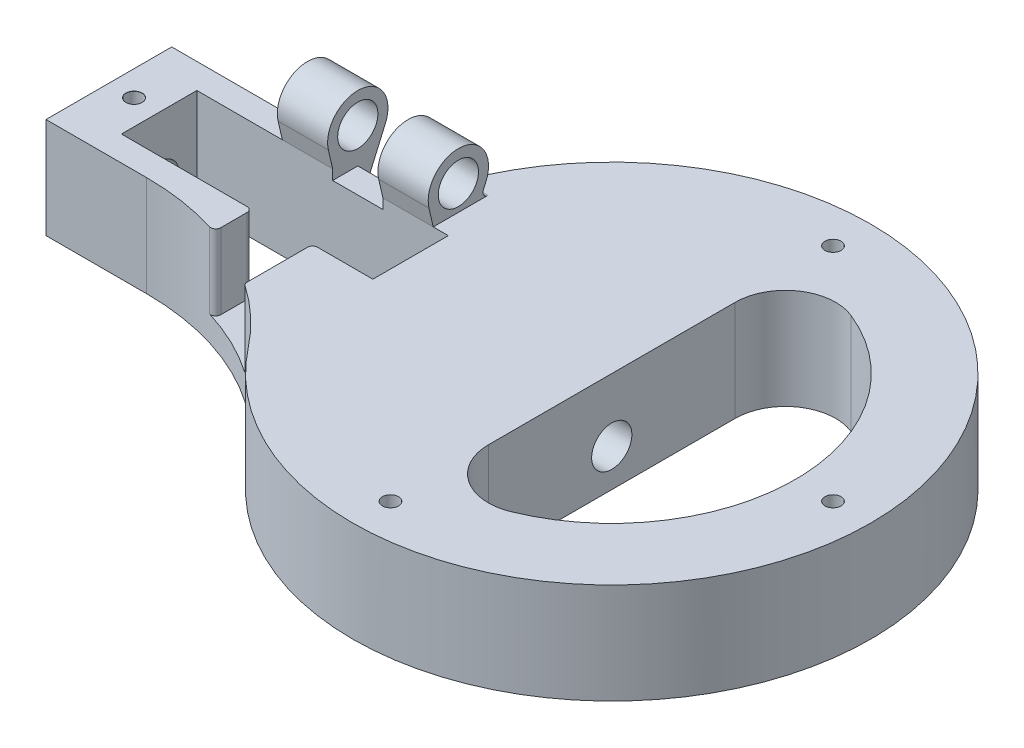
from build123d import *

# Parameters (mm, degrees)
SKETCH2_W                            = 100
SKETCH2_H                            = 25
SKETCH2_W_2                          = 40
SKETCH2_H_2                          = 15
BOSS_EXTRUDE1_DEPTH                  = 20
CUT_EXTRUDE1_REACH                   = 104.744
SKETCH3_R                            = 4
CUT_EXTRUDE2_REACH                   = 104.744
SKETCH4_R                            = 4
F_3_2_3_2_DIAMETER_HOLE1_D           = 3.2
F_3_2_3_2_DIAMETER_HOLE1_CSINK_D     = 3.25
F_3_2_3_2_DIAMETER_HOLE1_CSINK_ANGLE = 90
SKETCH9_R                            = 4
BOSS_EXTRUDE3_DEPTH                  = 40
CUT_EXTRUDE3_DEPTH                   = 71.434366612
CUT_EXTRUDE3_DEPTH_BACK              = 71.434366612
SKETCH12_W                           = 7
SKETCH12_H                           = 15
SKETCH12_W_2                         = 10
SKETCH12_W_3                         = 3
SKETCH11_R                           = 1.6
BOSS_EXTRUDE4_DEPTH                  = 20
FILLET1_R                            = 10
SKETCH13_W                           = 7
SKETCH13_H                           = 4.364357805
SKETCH13_W_2                         = 10
CUT_EXTRUDE4_DEPTH                   = 125.436730928
FILLET3_R                            = 1
FILLET4_R                            = 50
SKETCH14_W                           = 12
SKETCH14_H                           = 15
CUT_EXTRUDE5_DEPTH                   = 15
SKETCH15_W                           = 10
SKETCH15_H                           = 15
CUT_EXTRUDE6_DEPTH                   = 125.436731059
SKETCH16_W                           = 10
SKETCH16_H                           = 5
CUT_EXTRUDE7_DEPTH                   = 2
FILLET5_R                            = 1


with BuildPart() as part:
    # Sketch2 → Boss-Extrude1 (new body)
    with BuildSketch(Plane(origin=(0, 0, 0), x_dir=(1, 0, 0), z_dir=(0, 1, 0))):
        with Locations((10, 0)):
            Rectangle(SKETCH2_W, SKETCH2_H)
        Rectangle(SKETCH2_W_2, SKETCH2_H_2, mode=Mode.SUBTRACT)
    extrude(amount=BOSS_EXTRUDE1_DEPTH)

    # Sketch3 → Cut-Extrude1 (cut, up to next)
    with BuildSketch(Plane(origin=(60, 0, 0), x_dir=(0, 0, -1), z_dir=(1, 0, 0)), mode=Mode.PRIVATE) as cut_extrude1_sk1:
        with Locations((0, 7.5)):
            Circle(SKETCH3_R)
    cut_extrude1_tool1 = extrude(cut_extrude1_sk1.sketch, amount=-CUT_EXTRUDE1_REACH, mode=Mode.PRIVATE) & part.part
    add(cut_extrude1_tool1.solids().sort_by_distance((60, 7.5, 0))[0], mode=Mode.SUBTRACT)

    # Sketch4 → Cut-Extrude2 (cut, up to next)
    with BuildSketch(Plane.ZY.offset(40), mode=Mode.PRIVATE) as cut_extrude2_sk1:
        with Locations((0, 7.5)):
            Circle(SKETCH4_R)
    cut_extrude2_tool1 = extrude(cut_extrude2_sk1.sketch, amount=-CUT_EXTRUDE2_REACH, mode=Mode.PRIVATE) & part.part
    add(cut_extrude2_tool1.solids().sort_by_distance((-40, 7.5, 0))[0], mode=Mode.SUBTRACT)

    # Ø3.2 (3.2) Diameter Hole1 (through all)
    with Locations(Plane(origin=(0, 20, 0), x_dir=(1, 0, 0), z_dir=(0, 1, 0))):
        with Locations((-35, 0)):
            CounterSinkHole(F_3_2_3_2_DIAMETER_HOLE1_D / 2, F_3_2_3_2_DIAMETER_HOLE1_CSINK_D / 2, counter_sink_angle=F_3_2_3_2_DIAMETER_HOLE1_CSINK_ANGLE)

    # Sketch9 → Boss-Extrude3 (add)
    with BuildSketch(Plane(origin=(-20, 0, 0), x_dir=(0, 0, -1), z_dir=(1, 0, 0))):
        with BuildLine():
            Line((7.5, 20), (12.5, 20))
            Line((12.5, 20), (12.5, 10))
            Line((12.5, 10), (17.999090834, 22.6))
            ThreePointArc((17.999090834, 22.6), (13.050377748, 30.974703703), (6.655005568, 23.644994432))
            Line((6.655005568, 23.644994432), (7.5, 20))
        make_face()
        with Locations((12.5, 25)):
            Circle(SKETCH9_R, mode=Mode.SUBTRACT)
    extrude(amount=BOSS_EXTRUDE3_DEPTH)

    # Sketch12 → Cut-Extrude3 (cut, two sides: drawn at the far end of the back side and taken through both)
    with BuildSketch(Plane.XY.offset(-7.5).offset(-CUT_EXTRUDE3_DEPTH_BACK)):
        with Locations((-16.5, 27.5)):
            Rectangle(SKETCH12_W, SKETCH12_H)
        with Locations((2, 27.5)):
            Rectangle(SKETCH12_W_2, SKETCH12_H)
        with Locations((18.5, 27.5)):
            Rectangle(SKETCH12_W_3, SKETCH12_H)
    extrude(amount=CUT_EXTRUDE3_DEPTH + CUT_EXTRUDE3_DEPTH_BACK, mode=Mode.SUBTRACT)

    # Sketch11 → Boss-Extrude4 (add)
    with BuildSketch(Plane.XZ):
        with BuildLine():
            Line((60, 12.5), (60, 36.5))
            ThreePointArc((60, 36.5), (96.5, 0), (60, -36.5))
            Line((60, -36.5), (60, -12.5))
            Line((60, -12.5), (10.040016013, -12.5))
            ThreePointArc((10.040016013, -12.5), (111.5, 0), (10.040016013, 12.5))
            Line((10.040016013, 12.5), (60, 12.5))
        make_face()
        with Locations((60, 44)):
            Circle(SKETCH11_R, mode=Mode.SUBTRACT)
        with Locations((60, -44)):
            Circle(SKETCH11_R, mode=Mode.SUBTRACT)
        with Locations((104, 0)):
            Circle(SKETCH11_R, mode=Mode.SUBTRACT)
    extrude(amount=-BOSS_EXTRUDE4_DEPTH)

    # Fillet1
    fillet1_edges = [part.edges().sort_by_distance(p)[0] for p in [
        (60, 10, 36.5),
        (60, 10, -36.5),
    ]]
    fillet(fillet1_edges, radius=FILLET1_R)

    # Sketch13 → Cut-Extrude4 (cut, through all)
    with BuildSketch(Plane(origin=(0, 20, 0), x_dir=(1, 0, 0), z_dir=(0, 1, 0))):
        with Locations((-16.5, 14.682178903)):
            Rectangle(SKETCH13_W, SKETCH13_H)
        with Locations((2, 14.682178903)):
            Rectangle(SKETCH13_W_2, SKETCH13_H)
    extrude(amount=-CUT_EXTRUDE4_DEPTH, mode=Mode.SUBTRACT)

    # Fillet3
    fillet3_edges = [part.edges().sort_by_distance(p)[0] for p in [
        (-8, 10, -12.5),
        (14.169754236, 20, -16.864357805),
    ]]
    fillet(fillet3_edges, radius=FILLET3_R)

    # Fillet4
    fillet4_edges = [part.edges().sort_by_distance(p)[0] for p in [
        (10.040016013, 10, 12.5),
    ]]
    fillet(fillet4_edges, radius=FILLET4_R)

    # Sketch14 → Cut-Extrude5 (cut)
    with BuildSketch(Plane(origin=(0, 20, 0), x_dir=(1, 0, 0), z_dir=(0, 1, 0))):
        with Locations((2, -15)):
            Rectangle(SKETCH14_W, SKETCH14_H)
    extrude(amount=-CUT_EXTRUDE5_DEPTH, mode=Mode.SUBTRACT)

    # Sketch15 → Cut-Extrude6 (cut, through all)
    with BuildSketch(Plane(origin=(0, 20, 0), x_dir=(1, 0, 0), z_dir=(0, 1, 0))):
        with Locations((-25, 0)):
            Rectangle(SKETCH15_W, SKETCH15_H)
    extrude(amount=-CUT_EXTRUDE6_DEPTH, mode=Mode.SUBTRACT)

    # Sketch16 → Cut-Extrude7 (cut)
    with BuildSketch(Plane(origin=(0, 20, 0), x_dir=(1, 0, 0), z_dir=(0, 1, 0))):
        with Locations((2, 10)):
            Rectangle(SKETCH16_W, SKETCH16_H)
    extrude(amount=-CUT_EXTRUDE7_DEPTH, mode=Mode.SUBTRACT)

    # Fillet5
    fillet5_edges = [part.edges().sort_by_distance(p)[0] for p in [
        (8, 12.5, 7.5),
        (8, 12.5, 21.058479835),
        (-4, 12.5, 15.120684895),
        (-4, 12.5, 7.5),
    ]]
    fillet(fillet5_edges, radius=FILLET5_R)


solid = part.part
